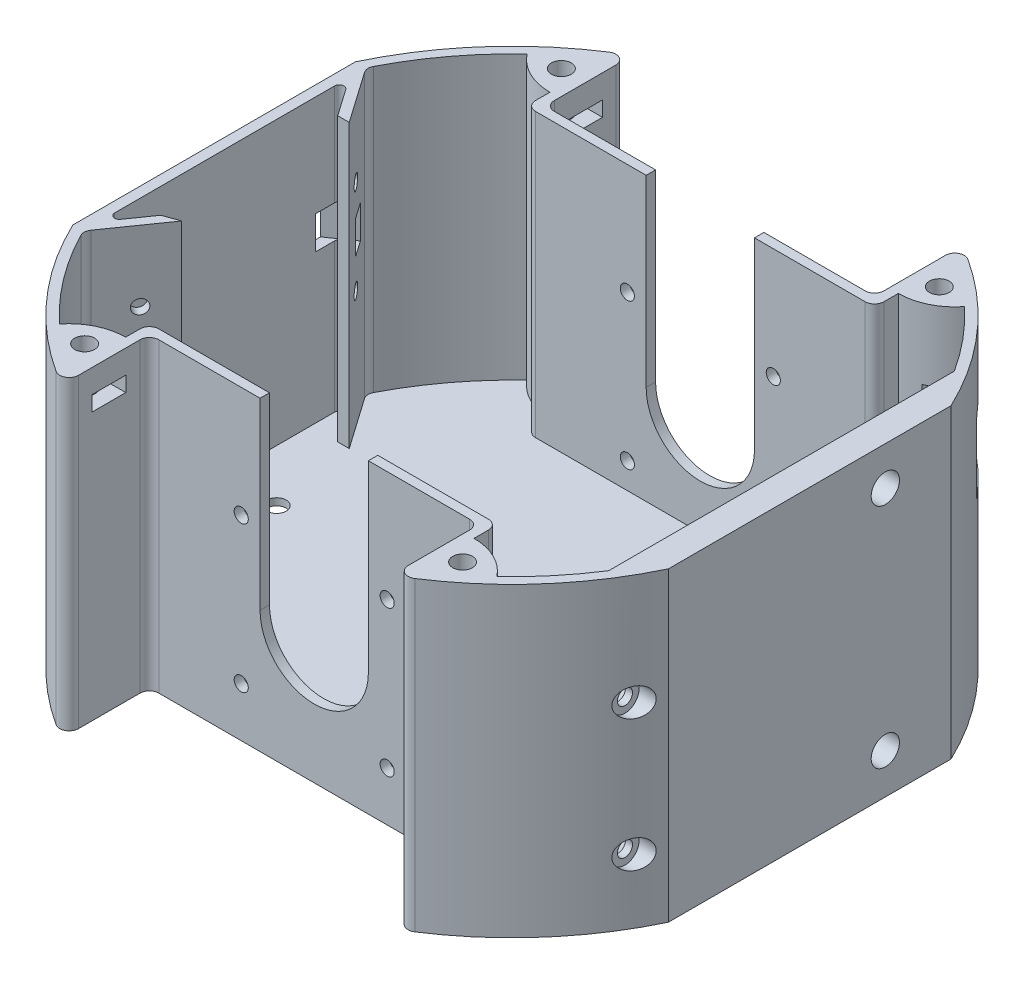
from build123d import *

# Parameters (mm, degrees)
ESQUISSE1_R                   = 2.05
BOSS_EXTRU_1_DEPTH            = 5
BOSS_EXTRU_2_DEPTH            = 60
ENL_V_MAT_EXTRU_1_DEPTH       = 136.461220507
ENL_V_MAT_EXTRU_1_DEPTH_BACK  = 136.461220507
ESQUISSE4_R                   = 1.5
ESQUISSE7_R                   = 2.1
ENL_V_MAT_EXTRU_2_DEPTH       = 13
ESQUISSE8_W                   = 7.2
ESQUISSE8_H                   = 3.2
ENL_V_MAT_EXTRU_3_DEPTH       = 5
ENL_V_START                   = -5
ESQUISSE10_R                  = 2.1
ENL_V_MAT_EXTRU_4_DEPTH       = 3.2
SYM_TRIE2_COPY_1_SKETCH_R     = 2.1
SYM_TRIE2_COPY_1_DEPTH        = 13
SYM_TRIE2_COPY_2_SKETCH_W     = 7.2
SYM_TRIE2_COPY_2_SKETCH_H     = 3.2
SYM_TRIE2_COPY_2_DEPTH        = 5
SYM_TRIE2_START               = -5
SYM_TRIE2_COPY_3_SKETCH_R     = 2.1
SYM_TRIE2_COPY_3_DEPTH        = 3.2
CONG_1_R                      = 2
CONG_2_R                      = 1
ESQUISSE13_R                  = 12.75
ESQUISSE13_R_2                = 2.05
ENL_V_MAT_EXTRU_5_DEPTH       = 3.5
ESQUISSE14_R                  = 1.5
ESQUISSE14_W                  = 4
ESQUISSE14_H                  = 7
ENL_V_MAT_EXTRU_6_DEPTH       = 5
ESQUISSE16_W                  = 4
ESQUISSE16_H                  = 7
ENL_V_MAT_EXTRU_8_DEPTH       = 136.661761577
ENL_V_MAT_EXTRU_10_DEPTH      = 2.5
ENL_V_MAT_EXTRU_10_DEPTH_BACK = 10
ESQUISSE18_R                  = 1.6
ENL_V_START_2                 = -4.5
ESQUISSE19_R                  = 3
ESQUISSE19_R_2                = 1.6
ENL_V_MAT_EXTRU_11_DEPTH      = 4.5
ENL_V_MAT_EXTRU_12_DEPTH      = 0.2
CHANFREIN1_SIZE               = 2
CHANFREIN1_SIZE_2             = 2.856296013
ESQUISSE21_W                  = 12
ESQUISSE21_H                  = 15
ENL_V_MAT_EXTRU_13_DEPTH      = 109.222966447


with BuildPart() as part:
    # Esquisse1 → Boss.-Extru.1 (new body)
    with BuildSketch(Plane(origin=(0, 0, 0), x_dir=(1, 0, 0), z_dir=(0, 1, 0))):
        with BuildLine():
            Line((35, 42), (-35, 42))
            Line((-35, 42), (-35, 60.621778265))
            ThreePointArc((-35, 60.621778265), (-51.453576232, 47.460820609), (-63.245553203, 30))
            Line((-63.245553203, 30), (-63.245553203, -30))
            ThreePointArc((-63.245553203, -30), (-51.453576232, -47.460820609), (-35, -60.621778265))
            Line((-35, -60.621778265), (-35, -42))
            Line((-35, -42), (35, -42))
            Line((35, -42), (35, -60.621778265))
            ThreePointArc((35, -60.621778265), (51.453576232, -47.460820609), (63.245553203, -30))
            Line((63.245553203, -30), (63.245553203, 30))
            ThreePointArc((63.245553203, 30), (51.453576232, 47.460820609), (35, 60.621778265))
            Line((35, 60.621778265), (35, 42))
        make_face()
        with Locations(Location((-50, 0, 0), (0, 0, 270))):
            Circle(ESQUISSE1_R, mode=Mode.SUBTRACT)
        with Locations(Location((50, 0, 0), (0, 0, 90))):
            Circle(ESQUISSE1_R, mode=Mode.SUBTRACT)
    extrude(amount=BOSS_EXTRU_1_DEPTH)

    # Esquisse3 → Boss.-Extru.2 (add)
    # profile 1 of 8: a face of its own
    with BuildSketch(Plane(origin=(0, 5, 0), x_dir=(1, 0, 0), z_dir=(0, 1, 0))):
        with BuildLine():
            Line((35, 42), (-35, 42))
            Line((-35, 42), (-35, 60.621778265))
            ThreePointArc((-35, 60.621778265), (-51.453576232, 47.460820609), (-63.245553203, 30))
            Line((-63.245553203, 30), (-63.245553203, -30))
            ThreePointArc((-63.245553203, -30), (-51.453576232, -47.460820609), (-35, -60.621778265))
            Line((-35, -60.621778265), (-35, -42))
            Line((-35, -42), (35, -42))
            Line((35, -42), (35, -60.621778265))
            ThreePointArc((35, -60.621778265), (51.453576232, -47.460820609), (63.245553203, -30))
            Line((63.245553203, -30), (63.245553203, 30))
            ThreePointArc((63.245553203, 30), (51.453576232, 47.460820609), (35, 60.621778265))
            Line((35, 60.621778265), (35, 42))
        make_face()
        with BuildLine():
            Line((37, 40), (37, 57.052607302))
            ThreePointArc((37, 57.052607302), (50.844524945, 45.153452616), (61.02458521, 30))
            Line((61.02458521, 30), (61.02458521, -30))
            ThreePointArc((61.02458521, -30), (50.844524945, -45.153452616), (37, -57.052607302))
            Line((37, -57.052607302), (37, -40))
            Line((37, -40), (-37, -40))
            Line((-37, -40), (-37, -57.052607302))
            ThreePointArc((-37, -57.052607302), (-50.844524945, -45.153452616), (-61.02458521, -30))
            Line((-61.02458521, -30), (-61.02458521, 30))
            ThreePointArc((-61.02458521, 30), (-50.844524945, 45.153452616), (-37, 57.052607302))
            Line((-37, 57.052607302), (-37, 40))
            Line((-37, 40), (37, 40))
        make_face(mode=Mode.SUBTRACT)
    # profile 2 of 8: a face of its own
    with BuildSketch(Plane(origin=(0, 5, 0), x_dir=(1, 0, 0), z_dir=(0, 1, 0))):
        Polygon((-61.02458521, 30), (-61.02458521, 26.513106409), (-54.059242753, 16.565566463), (-52.420938664, 17.712719336), align=None)
    # profile 3 of 8: a face of its own
    with BuildSketch(Plane(origin=(0, 5, 0), x_dir=(1, 0, 0), z_dir=(0, 1, 0))):
        with BuildLine():
            ThreePointArc((-37, -45.052607302), (-42.257961257, -46.265863428), (-46.452713564, -49.660300065))
            ThreePointArc((-46.452713564, -49.660300065), (-41.88974101, -53.56537686), (-37, -57.052607302))
            Line((-37, -57.052607302), (-37, -45.052607302))
        make_face()
    # profile 4 of 8: a face of its own
    with BuildSketch(Plane(origin=(0, 5, 0), x_dir=(1, 0, 0), z_dir=(0, 1, 0))):
        with BuildLine():
            Line((37, 57.052607302), (37, 45.052607302))
            ThreePointArc((37, 45.052607302), (42.257961257, 46.265863428), (46.452713564, 49.660300065))
            ThreePointArc((46.452713564, 49.660300065), (41.88974101, 53.56537686), (37, 57.052607302))
        make_face()
    # profile 5 of 8: a face of its own
    with BuildSketch(Plane(origin=(0, 5, 0), x_dir=(1, 0, 0), z_dir=(0, 1, 0))):
        with BuildLine():
            ThreePointArc((46.452713564, -49.660300065), (42.257961257, -46.265863428), (37, -45.052607302))
            Line((37, -45.052607302), (37, -57.052607302))
            ThreePointArc((37, -57.052607302), (41.88974101, -53.56537686), (46.452713564, -49.660300065))
        make_face()
    # profile 6 of 8: a face of its own
    with BuildSketch(Plane(origin=(0, 5, 0), x_dir=(1, 0, 0), z_dir=(0, 1, 0))):
        Polygon((-61.02458521, -26.513106409), (-61.02458521, -30), (-52.420938664, -17.712719336), (-54.059242753, -16.565566463), align=None)
    # profile 7 of 8: a face of its own
    with BuildSketch(Plane(origin=(0, 5, 0), x_dir=(1, 0, 0), z_dir=(0, 1, 0))):
        with BuildLine():
            Line((57.245553203, 36.700771633), (57.245553203, -36.700771633))
            ThreePointArc((57.245553203, -36.700771633), (59.229903724, -33.403869609), (61.02458521, -30))
            Line((61.02458521, -30), (61.02458521, 30))
            ThreePointArc((61.02458521, 30), (59.229903724, 33.403869609), (57.245553203, 36.700771633))
        make_face()
    # profile 8 of 8: a face of its own
    with BuildSketch(Plane(origin=(0, 5, 0), x_dir=(1, 0, 0), z_dir=(0, 1, 0))):
        with BuildLine():
            ThreePointArc((-37, 57.052607302), (-41.88974101, 53.56537686), (-46.452713564, 49.660300065))
            ThreePointArc((-46.452713564, 49.660300065), (-42.257961257, 46.265863428), (-37, 45.052607302))
            Line((-37, 45.052607302), (-37, 57.052607302))
        make_face()
    extrude(amount=BOSS_EXTRU_2_DEPTH)

    # Esquisse4 → Enlèv. mat.-Extru.1 (cut, two sides: drawn at the far end of the back side and taken through both)
    with BuildSketch(Plane.XY.offset(-40).offset(-ENL_V_MAT_EXTRU_1_DEPTH_BACK)):
        with BuildLine():
            Line((11.5, 26), (11.5, 65))
            Line((11.5, 65), (-11.5, 65))
            Line((-11.5, 65), (-11.5, 26))
            ThreePointArc((-11.5, 26), (0, 14.5), (11.5, 26))
        make_face()
        with Locations((-15.5, 10.5)):
            Circle(ESQUISSE4_R)
        with Locations((-15.5, 41.5)):
            Circle(ESQUISSE4_R)
        with Locations((15.5, 41.5)):
            Circle(ESQUISSE4_R)
        with Locations((15.5, 10.5)):
            Circle(ESQUISSE4_R)
    extrude(amount=ENL_V_MAT_EXTRU_1_DEPTH + ENL_V_MAT_EXTRU_1_DEPTH_BACK, mode=Mode.SUBTRACT)

    # Esquisse7 → Enlèv. mat.-Extru.2 (cut)
    with BuildSketch(Plane(origin=(0, 65, 0), x_dir=(1, 0, 0), z_dir=(0, 1, 0))):
        with Locations(Location((-40.134685529, -50.621778265, 0), (0, 0, 270))):
            Circle(ESQUISSE7_R)
    enl_v_mat_extru_2 = extrude(amount=-ENL_V_MAT_EXTRU_2_DEPTH, mode=Mode.SUBTRACT)

    # Esquisse8 → Enlèv. mat.-Extru.3 (cut)
    with BuildSketch(Plane(origin=(-35, 0, 0), x_dir=(0, 0, -1), z_dir=(1, 0, 0))):
        with Locations((-50.621778265, 58.4)):
            Rectangle(ESQUISSE8_W, ESQUISSE8_H)
    enl_v_mat_extru_3 = extrude(amount=-ENL_V_MAT_EXTRU_3_DEPTH, mode=Mode.SUBTRACT)

    # Esquisse10 → Enlèv. mat.-Extru.4 (cut)
    with BuildSketch(Plane(origin=(0, 65, 0), x_dir=(1, 0, 0), z_dir=(0, 1, 0)).offset(ENL_V_START)):
        Polygon((-35.977763591, -50.621778265), (-38.05622456, -47.021778265), (-42.213146498, -47.021778265), (-44.291607467, -50.621778265), (-42.213146498, -54.221778265), (-38.05622456, -54.221778265), align=None)
        with Locations(Location((-40.134685529, -50.621778265, 0), (0, 0, 270))):
            Circle(ESQUISSE10_R, mode=Mode.SUBTRACT)
    enl_v_mat_extru_4 = extrude(amount=-ENL_V_MAT_EXTRU_4_DEPTH, mode=Mode.SUBTRACT)

    # Symétrie1: Enlèv. mat.-Extru.2, Enlèv. mat.-Extru.3, Enlèv. mat.-Extru.4 across plane
    add(enl_v_mat_extru_2.mirror(Plane(origin=(0, 0, 0), x_dir=(0, 0, 1), z_dir=(1, 0, 0))), mode=Mode.SUBTRACT)
    add(enl_v_mat_extru_3.mirror(Plane(origin=(0, 0, 0), x_dir=(0, 0, 1), z_dir=(1, 0, 0))), mode=Mode.SUBTRACT)
    add(enl_v_mat_extru_4.mirror(Plane(origin=(0, 0, 0), x_dir=(0, 0, 1), z_dir=(1, 0, 0))), mode=Mode.SUBTRACT)

    # Symétrie2: Enlèv. mat.-Extru.2, Enlèv. mat.-Extru.3, Enlèv. mat.-Extru.4 across plane
    add(enl_v_mat_extru_2.mirror(Plane.XY), mode=Mode.SUBTRACT)
    add(enl_v_mat_extru_3.mirror(Plane.XY), mode=Mode.SUBTRACT)
    add(enl_v_mat_extru_4.mirror(Plane.XY), mode=Mode.SUBTRACT)

    # Symétrie2 copy 1 sketch → Symétrie2 copy 1 (cut)
    with BuildSketch(Plane(origin=(0, 65, 0), x_dir=(-1, 0, 0), z_dir=(0, 1, 0))):
        with Locations(Location((-40.134685529, -50.621778265, 0), (0, 0, 270))):
            Circle(SYM_TRIE2_COPY_1_SKETCH_R)
    extrude(amount=-SYM_TRIE2_COPY_1_DEPTH, mode=Mode.SUBTRACT)

    # Symétrie2 copy 2 sketch → Symétrie2 copy 2 (cut)
    with BuildSketch(Plane.ZY.offset(-35)):
        with Locations((-50.621778265, 58.4)):
            Rectangle(SYM_TRIE2_COPY_2_SKETCH_W, SYM_TRIE2_COPY_2_SKETCH_H)
    extrude(amount=-SYM_TRIE2_COPY_2_DEPTH, mode=Mode.SUBTRACT)

    # Symétrie2 copy 3 sketch → Symétrie2 copy 3 (cut)
    with BuildSketch(Plane(origin=(0, 65, 0), x_dir=(-1, 0, 0), z_dir=(0, 1, 0)).offset(SYM_TRIE2_START)):
        Polygon((-35.977763591, -50.621778265), (-38.05622456, -47.021778265), (-42.213146498, -47.021778265), (-44.291607467, -50.621778265), (-42.213146498, -54.221778265), (-38.05622456, -54.221778265), align=None)
        with Locations(Location((-40.134685529, -50.621778265, 0), (0, 0, 270))):
            Circle(SYM_TRIE2_COPY_3_SKETCH_R, mode=Mode.SUBTRACT)
    extrude(amount=-SYM_TRIE2_COPY_3_DEPTH, mode=Mode.SUBTRACT)

    # Congé1
    cong_1_edges = [part.edges().sort_by_distance(p)[0] for p in [
        (-35, 32.5, -42),
        (35, 32.5, -42),
        (35, 32.5, -60.621778265),
        (35, 32.5, 60.621778265),
        (35, 32.5, 42),
        (-35, 32.5, 42),
        (-35, 32.5, 60.621778265),
        (-35, 32.5, -60.621778265),
        (37, 35, 40),
        (-37, 35, 40),
        (-61.02458521, 35, 30),
        (-61.02458521, 35, -30),
        (-37, 35, -40),
        (37, 35, -40),
    ]]
    fillet(cong_1_edges, radius=CONG_1_R)

    # Congé2
    cong_2_edges = [part.edges().sort_by_distance(p)[0] for p in [
        (-61.02458521, 35, 26.513106409),
        (-61.02458521, 35, -26.513106409),
    ]]
    fillet(cong_2_edges, radius=CONG_2_R)

    # Esquisse13 → Enlèv. mat.-Extru.5 (cut)
    # profile 1 of 2: a face of its own
    with BuildSketch(Plane.XZ):
        with Locations(Location((-50, 0, 0), (0, 0, 270))):
            Circle(ESQUISSE13_R)
        with Locations(Location((-50, 0, 0), (0, 0, 270))):
            Circle(ESQUISSE13_R_2, mode=Mode.SUBTRACT)
    # profile 2 of 2: a face of its own
    with BuildSketch(Plane.XZ):
        with Locations(Location((50, 0, 0), (0, 0, 270))):
            Circle(ESQUISSE13_R)
        with Locations(Location((50, 0, 0), (0, 0, 270))):
            Circle(ESQUISSE13_R_2, mode=Mode.SUBTRACT)
    extrude(amount=-ENL_V_MAT_EXTRU_5_DEPTH, mode=Mode.SUBTRACT)

    # Esquisse14 → Enlèv. mat.-Extru.6 (cut)
    with BuildSketch(Plane(origin=(-26.852721983, 0, -18.802478354), x_dir=(0.5735764363510413, 0, -0.8191520442889951), z_dir=(0.8191520442889951, 0, 0.5735764363510413))):
        with Locations((-50.926825443, 50)):
            Circle(ESQUISSE14_R)
        with Locations((-50.926825443, 30)):
            Circle(ESQUISSE14_R)
        with Locations((-52.776825443, 40)):
            Rectangle(ESQUISSE14_W, ESQUISSE14_H)
    enl_v_mat_extru_6 = extrude(amount=-ENL_V_MAT_EXTRU_6_DEPTH, mode=Mode.SUBTRACT)

    # Esquisse16 → Enlèv. mat.-Extru.8 (cut, through all)
    with BuildSketch(Plane(origin=(-26.852721983, 0, -18.802478354), x_dir=(0.5735764363510413, 0, -0.8191520442889951), z_dir=(0.8191520442889951, 0, 0.5735764363510413))):
        with Locations((-52.776825443, 40)):
            Rectangle(ESQUISSE16_W, ESQUISSE16_H)
    enl_v_mat_extru_8 = extrude(amount=-ENL_V_MAT_EXTRU_8_DEPTH, mode=Mode.SUBTRACT)

    # Symétrie3: Enlèv. mat.-Extru.6, Enlèv. mat.-Extru.8 across plane
    add(enl_v_mat_extru_6.mirror(Plane.XY), mode=Mode.SUBTRACT)
    add(enl_v_mat_extru_8.mirror(Plane.XY), mode=Mode.SUBTRACT)

    # Esquisse18 → Enlèv. mat.-Extru.10 (cut, two sides: drawn at the far end of the back side and taken through both)
    with BuildSketch(Plane.ZY.offset(-57.245553203).offset(-ENL_V_MAT_EXTRU_10_DEPTH_BACK)):
        with Locations(Location((-16.05, 56.8, 0), (0, 0, 180))):
            Circle(ESQUISSE18_R)
        with Locations(Location((-16.05, 8.54, 0), (0, 0, 180))):
            Circle(ESQUISSE18_R)
        with Locations(Location((34.75, 41.56, 0), (0, 0, 180))):
            Circle(ESQUISSE18_R)
        with Locations(Location((34.75, 13.62, 0), (0, 0, 180))):
            Circle(ESQUISSE18_R)
    extrude(amount=ENL_V_MAT_EXTRU_10_DEPTH + ENL_V_MAT_EXTRU_10_DEPTH_BACK, mode=Mode.SUBTRACT)

    # Esquisse19 → Enlèv. mat.-Extru.11 (cut)
    # profile 1 of 4: a face of its own
    with BuildSketch(Plane(origin=(63.245553203, 0, 0), x_dir=(0, 0, -1), z_dir=(1, 0, 0)).offset(ENL_V_START_2)):
        with Locations((-34.75, 41.56)):
            Circle(ESQUISSE19_R)
        with Locations((-34.75, 41.56)):
            Circle(ESQUISSE19_R_2, mode=Mode.SUBTRACT)
    # profile 2 of 4: a face of its own
    with BuildSketch(Plane(origin=(63.245553203, 0, 0), x_dir=(0, 0, -1), z_dir=(1, 0, 0)).offset(ENL_V_START_2)):
        with Locations((16.05, 56.8)):
            Circle(ESQUISSE19_R)
        with Locations((16.05, 56.8)):
            Circle(ESQUISSE19_R_2, mode=Mode.SUBTRACT)
    # profile 3 of 4: a face of its own
    with BuildSketch(Plane(origin=(63.245553203, 0, 0), x_dir=(0, 0, -1), z_dir=(1, 0, 0)).offset(ENL_V_START_2)):
        with Locations((-34.75, 13.62)):
            Circle(ESQUISSE19_R)
        with Locations((-34.75, 13.62)):
            Circle(ESQUISSE19_R_2, mode=Mode.SUBTRACT)
    # profile 4 of 4: a face of its own
    with BuildSketch(Plane(origin=(63.245553203, 0, 0), x_dir=(0, 0, -1), z_dir=(1, 0, 0)).offset(ENL_V_START_2)):
        with Locations((16.05, 8.54)):
            Circle(ESQUISSE19_R)
        with Locations((16.05, 8.54)):
            Circle(ESQUISSE19_R_2, mode=Mode.SUBTRACT)
    extrude(amount=ENL_V_MAT_EXTRU_11_DEPTH, mode=Mode.SUBTRACT)

    # Esquisse20 → Enlèv. mat.-Extru.12 (cut)
    # profile 1 of 7: a face of its own
    with BuildSketch(Plane.XZ):
        Polygon((-6.879166667, 16.896126302), (-6.879166667, 18.168055556), (0, 18.168055556), (0, 17.550694444), (-6.173611111, 17.550694444), (-6.173611111, 16.492361111), align=None)
    # profile 2 of 7: a face of its own
    with BuildSketch(Plane.XZ):
        Polygon((-6.879166667, 8.819444444), (-6.879166667, 9.480902778), (-1.45796441, 11.773958333), (-6.879166667, 14.067013889), (-6.879166667, 14.728472222), (0, 11.818055556), (0, 11.729861111), align=None)
    # profile 3 of 7: a face of its own
    with BuildSketch(Plane.XZ):
        with BuildLine():
            Line((-1.5875, 4.478624132), (-1.299490017, 5.027083333))
            add(Edge.make_bspline(
                [(-1.299490017, 5.027083333), (-1.221983466, 4.983354906), (-1.071186411, 4.898276703), (-0.863997765, 4.752562347), (-0.67871717, 4.598413062), (-0.518311501, 4.431138699), (-0.376653377, 4.255779942), (-0.254465324, 4.069006183), (-0.149542627, 3.872341941), (-0.063568268, 3.663621059), (0.004021076, 3.443093562), (0.053936267, 3.209479795), (0.082882335, 2.96167672), (0.086395517, 2.79198151), (0.088194444, 2.705088976)],
                knots=[0, 0, 0, 0, 1.120611642, 2.180266485, 3.186550691, 4.152466804, 5.095166165, 6.022949561, 6.960161436, 7.899497276, 8.862391909, 9.862399089, 10.905440174, 12, 12, 12, 12], degree=3))
            add(Edge.make_bspline(
                [(0.088194444, 2.705088976), (0.085939699, 2.608501589), (0.081541343, 2.420087579), (0.043622464, 2.145825526), (-0.018235711, 1.887602416), (-0.104648924, 1.645432718), (-0.217521004, 1.419909656), (-0.355024545, 1.210584377), (-0.516454125, 1.016358409), (-0.703204444, 0.843343387), (-0.903066216, 0.687611956), (-1.111289961, 0.550100205), (-1.327154576, 0.435670714), (-1.549375714, 0.341166728), (-1.7774484, 0.266620991), (-2.012678834, 0.213647642), (-2.254134258, 0.183392775), (-2.417456698, 0.178735748), (-2.499761285, 0.176388889)],
                knots=[0, 0, 0, 0, 1.14524686, 2.234044844, 3.276713788, 4.290115724, 5.276966211, 6.260758605, 7.254862358, 8.264742877, 9.274005885, 10.257798278, 11.220590477, 12.167824544, 13.118936889, 14.062732937, 15.023735098, 16, 16, 16, 16], degree=3))
            add(Edge.make_bspline(
                [(-2.499761285, 0.176388889), (-2.576994338, 0.178470606), (-2.730060051, 0.182596294), (-2.956611735, 0.208601092), (-3.176800991, 0.254688154), (-3.390810781, 0.317929952), (-3.59828278, 0.399597937), (-3.799343257, 0.499507454), (-3.993778264, 0.617814139), (-4.116430138, 0.709155073), (-4.178211806, 0.755164931)],
                knots=[0, 0, 0, 0, 1.024358464, 2.0301432, 3.019427413, 4.004406732, 4.986367066, 5.972626655, 6.978780325, 8, 8, 8, 8], degree=3))
            add(Edge.make_bspline(
                [(-4.178211806, 0.755164931), (-4.252765578, 0.817378186), (-4.399271971, 0.939634101), (-4.590021088, 1.148557853), (-4.753190652, 1.371737242), (-4.886304705, 1.611417185), (-4.988690458, 1.867193955), (-5.06151609, 2.137748275), (-5.106831525, 2.42382795), (-5.112419556, 2.619938697), (-5.115277778, 2.720247396)],
                knots=[0, 0, 0, 0, 1.030811313, 2.025658015, 2.997072178, 3.962767568, 4.930766827, 5.917075773, 6.934604948, 8, 8, 8, 8], degree=3))
            add(Edge.make_bspline(
                [(-5.115277778, 2.720247396), (-5.112629756, 2.823337843), (-5.107434941, 3.0255778), (-5.058844141, 3.320378612), (-4.982723733, 3.599873073), (-4.871819912, 3.861754657), (-4.734347051, 4.110058574), (-4.560587791, 4.339070136), (-4.359466614, 4.555075861), (-4.204634642, 4.680673494), (-4.125846354, 4.744585503)],
                knots=[0, 0, 0, 0, 1.056389096, 2.072394598, 3.055233004, 4.020130009, 4.981825462, 5.957811105, 6.960805292, 8, 8, 8, 8], degree=3))
            add(Edge.make_bspline(
                [(-4.125846354, 4.744585503), (-4.066481934, 4.788075474), (-3.948148241, 4.874765932), (-3.755195169, 4.983352792), (-3.553319942, 5.07761191), (-3.339259346, 5.152954432), (-3.115549671, 5.213961833), (-2.880591646, 5.258100175), (-2.634455237, 5.283984747), (-2.466747923, 5.28907277), (-2.38125, 5.291666667)],
                knots=[0, 0, 0, 0, 0.94817472, 1.890038105, 2.849395472, 3.817997239, 4.812318967, 5.836947057, 6.897266129, 8, 8, 8, 8], degree=3))
            Line((-2.38125, 5.291666667), (-2.38125, 0.79375))
            add(Edge.make_bspline(
                [(-2.38125, 0.79375), (-2.31501254, 0.79677606), (-2.184759246, 0.802726684), (-1.994165481, 0.830469662), (-1.812607876, 0.874199097), (-1.641448231, 0.935657695), (-1.478451039, 1.010084078), (-1.324825417, 1.1012541), (-1.181271104, 1.210022676), (-1.046504028, 1.331343068), (-0.926490556, 1.466385228), (-0.819073791, 1.608455247), (-0.729043981, 1.759587718), (-0.655967793, 1.918590975), (-0.598760022, 2.0852079), (-0.559710293, 2.259490989), (-0.533555491, 2.441097286), (-0.530647245, 2.564894247), (-0.529166667, 2.627918837)],
                knots=[0, 0, 0, 0, 1.094153842, 2.151609401, 3.174256925, 4.172055639, 5.149267565, 6.128595816, 7.11444997, 8.118368179, 9.117203808, 10.09244225, 11.054858984, 12.015122123, 12.976791628, 13.957293641, 14.960065497, 16, 16, 16, 16], degree=3))
            add(Edge.make_bspline(
                [(-0.529166667, 2.627918837), (-0.530352164, 2.68954146), (-0.532704417, 2.811812564), (-0.555904976, 2.993856358), (-0.592675848, 3.173266637), (-0.645637087, 3.348261906), (-0.707653984, 3.516291827), (-0.780647472, 3.672756347), (-0.86386831, 3.815586925), (-0.958438368, 3.949601613), (-1.074500667, 4.07888554), (-1.217943525, 4.209166165), (-1.390393873, 4.345778012), (-1.519325527, 4.432675717), (-1.5875, 4.478624132)],
                knots=[0, 0, 0, 0, 0.991168677, 1.966668791, 2.94808785, 3.9350306, 4.905702032, 5.828266021, 6.709360349, 7.562606342, 8.463112863, 9.498839253, 10.677475166, 12, 12, 12, 12], degree=3))
        make_face()
        with BuildLine():
            add(Edge.make_bspline(
                [(-2.998611111, 4.674305556), (-3.080539419, 4.651800719), (-3.237815153, 4.608598745), (-3.455527924, 4.516592633), (-3.650133212, 4.415472717), (-3.818397111, 4.293744236), (-3.96807722, 4.15716955), (-4.096789521, 3.997237291), (-4.215421183, 3.820883904), (-4.314213114, 3.624596786), (-4.395396303, 3.416116522), (-4.455091041, 3.199728206), (-4.490181398, 2.977244287), (-4.495326123, 2.827395976), (-4.497916667, 2.751942274)],
                knots=[0, 0, 0, 0, 1.155085888, 2.217389643, 3.210301801, 4.133263417, 5.03575695, 5.95948047, 6.920061569, 7.923798377, 8.943125483, 9.960783337, 10.973185325, 12, 12, 12, 12], degree=3))
            add(Edge.make_bspline(
                [(-4.497916667, 2.751942274), (-4.49672846, 2.690320991), (-4.494379625, 2.568508669), (-4.471632805, 2.389126623), (-4.435081191, 2.216409749), (-4.38133767, 2.050873598), (-4.315942426, 1.891420109), (-4.23555844, 1.7381645), (-4.138372794, 1.593076898), (-4.064133187, 1.502397352), (-4.026627604, 1.456586372)],
                knots=[0, 0, 0, 0, 1.048823158, 2.073302879, 3.073550078, 4.050623576, 5.03253758, 6.005186856, 6.992227572, 8, 8, 8, 8], degree=3))
            add(Edge.make_bspline(
                [(-4.026627604, 1.456586372), (-3.996963204, 1.423770981), (-3.936929689, 1.357360629), (-3.833439568, 1.268718267), (-3.721779786, 1.18321339), (-3.597076292, 1.107229847), (-3.462945351, 1.03501877), (-3.318408243, 0.969215756), (-3.162854873, 0.909384609), (-3.054406359, 0.87579776), (-2.998611111, 0.858517795)],
                knots=[0, 0, 0, 0, 0.879905587, 1.780714457, 2.708106151, 3.677566983, 4.684151534, 5.740052498, 6.837288539, 8, 8, 8, 8], degree=3))
            Line((-2.998611111, 0.858517795), (-2.998611111, 4.674305556))
        make_face(mode=Mode.SUBTRACT)
    # profile 4 of 7: a face of its own
    with BuildSketch(Plane.XZ):
        with BuildLine():
            Line((-5.027083333, -1.675694444), (-5.027083333, -1.058333333))
            Line((-5.027083333, -1.058333333), (-1.03766276, -1.058333333))
            add(Edge.make_bspline(
                [(-1.03766276, -1.058333333), (-0.952680298, -1.058877854), (-0.788643674, -1.05992891), (-0.551453389, -1.067497902), (-0.332369452, -1.0834589), (-0.130392679, -1.101558344), (0.05354073, -1.127594449), (0.219979622, -1.159388714), (0.369083716, -1.195230507), (0.460920279, -1.226717863), (0.504361979, -1.241612413)],
                knots=[0, 0, 0, 0, 1.307562039, 2.523909702, 3.650326591, 4.686913197, 5.643429486, 6.506965704, 7.293745905, 8, 8, 8, 8], degree=3))
            add(Edge.make_bspline(
                [(0.504361979, -1.241612413), (0.560829824, -1.263604702), (0.67207716, -1.306931724), (0.829777708, -1.388076127), (0.978255293, -1.478953423), (1.116724544, -1.582722854), (1.244333597, -1.699041093), (1.364248326, -1.824492218), (1.471957318, -1.963477334), (1.568754224, -2.113562734), (1.6576407, -2.271718128), (1.733474541, -2.439132752), (1.796723187, -2.614907199), (1.84876585, -2.79823042), (1.890751591, -2.989091713), (1.918765075, -3.188126415), (1.937628129, -3.394661899), (1.939385954, -3.535083693), (1.940277778, -3.606325955)],
                knots=[0, 0, 0, 0, 0.98202571, 1.934689484, 2.871054655, 3.802072519, 4.735470746, 5.668036537, 6.612630213, 7.581518814, 8.561763468, 9.551722253, 10.55777311, 11.588015789, 12.63986657, 13.723744117, 14.845153492, 16, 16, 16, 16], degree=3))
            add(Edge.make_bspline(
                [(1.940277778, -3.606325955), (1.938383265, -3.710240564), (1.934683764, -3.913159344), (1.899321914, -4.209613212), (1.842282772, -4.490243953), (1.761015315, -4.753006308), (1.660520708, -4.99525654), (1.545398724, -5.215641777), (1.413328624, -5.412130527), (1.26297136, -5.589266994), (1.084183616, -5.749141804), (0.87348708, -5.899554415), (0.627671014, -6.044333229), (0.447254633, -6.129180161), (0.352777778, -6.173611111)],
                knots=[0, 0, 0, 0, 1.157856589, 2.260999188, 3.322382479, 4.345906448, 5.321474636, 6.242187631, 7.112686896, 7.955149481, 8.825136643, 9.778649332, 10.836767353, 12, 12, 12, 12], degree=3))
            Line((0.352777778, -6.173611111), (0.352777778, -5.55625))
            add(Edge.make_bspline(
                [(0.352777778, -5.55625), (0.43157965, -5.506575219), (0.585627606, -5.409467138), (0.785283717, -5.228474439), (0.954345813, -5.028664365), (1.091520308, -4.805797368), (1.19712204, -4.558319072), (1.270471831, -4.284628383), (1.314848032, -3.983976293), (1.320153766, -3.774607849), (1.322916667, -3.665581597)],
                knots=[0, 0, 0, 0, 0.997887113, 1.950746426, 2.877762071, 3.798308985, 4.747694893, 5.754452072, 6.830656281, 8, 8, 8, 8], degree=3))
            add(Edge.make_bspline(
                [(1.322916667, -3.665581597), (1.320117504, -3.557933837), (1.314720998, -3.350399729), (1.270454212, -3.052042597), (1.197099223, -2.779244651), (1.091735715, -2.53501885), (0.965177498, -2.320884574), (0.825207573, -2.13522515), (0.665506462, -1.986040584), (0.518604971, -1.885314842), (0.38764454, -1.822760746), (0.274926657, -1.782888556), (0.147875795, -1.750732102), (0.006188781, -1.723128123), (-0.150188767, -1.701255095), (-0.321790142, -1.686904187), (-0.507454674, -1.676718622), (-0.636178842, -1.676043731), (-0.702799479, -1.675694444)],
                knots=[0, 0, 0, 0, 1.570880491, 3.028500349, 4.391799536, 5.683507043, 6.897971719, 8.016608159, 9.065046722, 10.074948333, 10.602832593, 11.179761774, 11.817338097, 12.514350094, 13.286299219, 14.121078732, 15.027572402, 16, 16, 16, 16], degree=3))
            Line((-0.702799479, -1.675694444), (-0.963248698, -1.675694444))
            add(Edge.make_bspline(
                [(-0.963248698, -1.675694444), (-0.888705256, -1.738377124), (-0.740929567, -1.862639915), (-0.546944401, -2.076660108), (-0.381893665, -2.311899456), (-0.244604502, -2.565032773), (-0.135831829, -2.832287521), (-0.057016536, -3.108938608), (-0.008129607, -3.394209367), (-0.002729087, -3.587298741), (0, -3.684874132)],
                knots=[0, 0, 0, 0, 1.012670515, 2.007528466, 2.995541538, 3.996581493, 4.997861088, 5.991949332, 6.98525577, 8, 8, 8, 8], degree=3))
            add(Edge.make_bspline(
                [(0, -3.684874132), (-0.001212435, -3.742315502), (-0.003622055, -3.856475726), (-0.018279928, -4.026555808), (-0.046823755, -4.19335802), (-0.083374257, -4.357944907), (-0.132369183, -4.519166623), (-0.18987356, -4.678954897), (-0.260504144, -4.834989229), (-0.340024489, -4.988065755), (-0.429371126, -5.134583067), (-0.525903102, -5.274080491), (-0.629414647, -5.405700063), (-0.740847713, -5.528222402), (-0.86006169, -5.641478007), (-0.98578029, -5.746992474), (-1.119760462, -5.843020398), (-1.259558786, -5.93153246), (-1.406106511, -6.008299144), (-1.556225838, -6.075684261), (-1.709595787, -6.134273936), (-1.866729835, -6.180984268), (-2.027528919, -6.216659849), (-2.191729613, -6.243213878), (-2.359837554, -6.258275188), (-2.473090944, -6.260623783), (-2.530078125, -6.261805556)],
                knots=[0, 0, 0, 0, 1.028710361, 2.044481286, 3.053267669, 4.056977562, 5.061496029, 6.068537106, 7.095799505, 8.125955792, 9.155750787, 10.166547241, 11.162135275, 12.151998358, 13.129411568, 14.10464185, 15.088574784, 16.079052837, 17.065149435, 18.048153627, 19.024354702, 20.002874835, 20.980703288, 21.971932454, 22.97951087, 24, 24, 24, 24], degree=3))
            add(Edge.make_bspline(
                [(-2.530078125, -6.261805556), (-2.58708302, -6.260785147), (-2.700872021, -6.258748281), (-2.869665908, -6.241155344), (-3.036199596, -6.216059772), (-3.198756548, -6.176341883), (-3.359188054, -6.128536544), (-3.516309118, -6.069329379), (-3.670167595, -5.99814227), (-3.820877422, -5.917538584), (-3.966416247, -5.826961397), (-4.104641595, -5.727641009), (-4.234536323, -5.619457516), (-4.357410862, -5.503903405), (-4.472079678, -5.379567741), (-4.57826446, -5.246514845), (-4.677745123, -5.106056256), (-4.768375859, -4.957756655), (-4.848532393, -4.803904312), (-4.921672866, -4.648407986), (-4.979721475, -4.489207884), (-5.030869257, -4.329272095), (-5.067103194, -4.165783953), (-5.095056672, -4.00074804), (-5.112086975, -3.83359935), (-5.114212804, -3.721659791), (-5.115277778, -3.665581597)],
                knots=[0, 0, 0, 0, 1.008818848, 2.013730394, 3.001654427, 3.987803273, 4.973046549, 5.963777569, 6.957074694, 7.972068341, 8.987420212, 9.989399531, 10.982630087, 11.977756091, 12.973280677, 13.973972381, 14.989194003, 16.018387222, 17.047741039, 18.059210846, 19.057554164, 20.045176975, 21.029480261, 22.018708529, 23.007435371, 24, 24, 24, 24], degree=3))
            add(Edge.make_bspline(
                [(-5.115277778, -3.665581597), (-5.112611269, -3.573104097), (-5.107345733, -3.390489449), (-5.066029172, -3.121747919), (-5.000158177, -2.862418588), (-4.905784598, -2.611038083), (-4.776947559, -2.365558655), (-4.60724255, -2.126789354), (-4.395147347, -1.894039365), (-4.232498562, -1.750406629), (-4.147894965, -1.675694444)],
                knots=[0, 0, 0, 0, 0.96728863, 1.910097829, 2.838038873, 3.762875196, 4.71315279, 5.730631239, 6.819562287, 8, 8, 8, 8], degree=3))
            Line((-4.147894965, -1.675694444), (-5.027083333, -1.675694444))
        make_face()
        with BuildLine():
            add(Edge.make_bspline(
                [(-4.497916667, -3.615972222), (-4.49483717, -3.706242186), (-4.488740419, -3.884957573), (-4.437045922, -4.14701627), (-4.355224307, -4.399423881), (-4.241338204, -4.63969163), (-4.097406392, -4.862284689), (-3.926165232, -5.061487482), (-3.729963981, -5.235164187), (-3.511330174, -5.382120291), (-3.275089171, -5.499516024), (-3.026188148, -5.581521855), (-2.768974992, -5.635726768), (-2.593742815, -5.641519746), (-2.505273438, -5.644444444)],
                knots=[0, 0, 0, 0, 1.026191648, 2.031641866, 3.026511193, 4.038688626, 5.047555432, 6.033268986, 7.01798463, 8.019529538, 9.022150945, 10.008736843, 10.994672018, 12, 12, 12, 12], degree=3))
            add(Edge.make_bspline(
                [(-2.505273438, -5.644444444), (-2.438580559, -5.643012255), (-2.307415171, -5.640195558), (-2.114889763, -5.6133039), (-1.931239661, -5.569308863), (-1.756639287, -5.508525472), (-1.591066389, -5.4308562), (-1.434532526, -5.335060019), (-1.286950077, -5.221671891), (-1.149564389, -5.092249912), (-1.024442805, -4.949597069), (-0.914497243, -4.794877873), (-0.824575471, -4.628293043), (-0.746858847, -4.453942029), (-0.69009774, -4.267593715), (-0.646781041, -4.071932365), (-0.621998829, -3.865573683), (-0.618927187, -3.724901134), (-0.617361111, -3.653179253)],
                knots=[0, 0, 0, 0, 1.039710933, 2.044807362, 3.024849673, 3.981007225, 4.923240656, 5.871799057, 6.837597342, 7.820855272, 8.810901995, 9.792827897, 10.773995565, 11.758948565, 12.765014796, 13.806304263, 14.881544521, 16, 16, 16, 16], degree=3))
            add(Edge.make_bspline(
                [(-0.617361111, -3.653179253), (-0.618869828, -3.580527867), (-0.621820109, -3.43845885), (-0.647181628, -3.230961688), (-0.688106727, -3.034349719), (-0.746212149, -2.848803219), (-0.820353352, -2.673621621), (-0.914178537, -2.510772849), (-1.021030534, -2.356765116), (-1.145665338, -2.216515792), (-1.283022632, -2.089695081), (-1.432487062, -1.979174847), (-1.591809583, -1.885000139), (-1.760972233, -1.807014623), (-1.941289644, -1.747477983), (-2.132311043, -1.707541659), (-2.333121266, -1.679618639), (-2.470721535, -1.677022393), (-2.541102431, -1.675694444)],
                knots=[0, 0, 0, 0, 1.121943988, 2.193949579, 3.223793937, 4.220241907, 5.192961521, 6.155822191, 7.11847367, 8.083710714, 9.04790392, 10.001595906, 10.949595423, 11.902125208, 12.873731292, 13.87582262, 14.913508608, 16, 16, 16, 16], degree=3))
            add(Edge.make_bspline(
                [(-2.541102431, -1.675694444), (-2.632726765, -1.678332058), (-2.811728517, -1.683485028), (-3.072587839, -1.731960415), (-3.318113353, -1.810595688), (-3.547676815, -1.919728848), (-3.758080711, -2.057114433), (-3.943997074, -2.224210584), (-4.110553306, -2.413623454), (-4.247501686, -2.629985162), (-4.359130086, -2.86156726), (-4.440160017, -3.10495427), (-4.487861275, -3.357791723), (-4.494545579, -3.529416751), (-4.497916667, -3.615972222)],
                knots=[0, 0, 0, 0, 1.070678282, 2.091729125, 3.090678259, 4.078281522, 5.055707048, 6.018451281, 6.993304669, 7.996175111, 9.002951586, 9.993356152, 10.987991402, 12, 12, 12, 12], degree=3))
        make_face(mode=Mode.SUBTRACT)
    # profile 5 of 7: a face of its own
    with BuildSketch(Plane.XZ):
        with BuildLine():
            Line((-5.027083333, -9.172222222), (-5.027083333, -8.554861111))
            Line((-5.027083333, -8.554861111), (-4.287076823, -8.554861111))
            add(Edge.make_bspline(
                [(-4.287076823, -8.554861111), (-4.356009064, -8.50931332), (-4.487841441, -8.422203524), (-4.661964192, -8.276738989), (-4.807777277, -8.129329112), (-4.922500018, -7.976103179), (-5.009202395, -7.818563452), (-5.070125439, -7.658038379), (-5.107905673, -7.494135419), (-5.112817118, -7.383723886), (-5.115277778, -7.328407118)],
                knots=[0, 0, 0, 0, 1.280091057, 2.448164201, 3.510831157, 4.48793739, 5.405868014, 6.289422536, 7.142991551, 8, 8, 8, 8], degree=3))
            add(Edge.make_bspline(
                [(-5.115277778, -7.328407118), (-5.112937826, -7.285507993), (-5.108123223, -7.197240255), (-5.074295757, -7.063622094), (-5.020288358, -6.925953357), (-4.969500016, -6.837227069), (-4.943023003, -6.790972222)],
                knots=[0, 0, 0, 0, 0.901110191, 1.854092781, 2.881294221, 4, 4, 4, 4], degree=3))
            Line((-4.943023003, -6.790972222), (-4.408344184, -7.129969618))
            add(Edge.make_bspline(
                [(-4.408344184, -7.129969618), (-4.421592017, -7.159666039), (-4.446738939, -7.216035532), (-4.476500199, -7.298496233), (-4.49402422, -7.374523479), (-4.496679023, -7.422959807), (-4.497916667, -7.445540365)],
                knots=[0, 0, 0, 0, 1.180555205, 2.24091978, 3.179933427, 4, 4, 4, 4], degree=3))
            add(Edge.make_bspline(
                [(-4.497916667, -7.445540365), (-4.494640453, -7.495096508), (-4.487957925, -7.596176675), (-4.434672558, -7.74408138), (-4.351055661, -7.888888575), (-4.255840737, -8.002784449), (-4.164378476, -8.091283679), (-4.084328828, -8.154930079), (-3.99373845, -8.212053671), (-3.89610886, -8.267465072), (-3.788989834, -8.318946447), (-3.672206621, -8.364952619), (-3.546723572, -8.407977246), (-3.459472282, -8.432206733), (-3.414778646, -8.444618056)],
                knots=[0, 0, 0, 0, 1.125322384, 2.295331465, 3.535939348, 4.916963136, 5.656144286, 6.429838446, 7.238666481, 8.090384391, 8.983239461, 9.940052224, 10.944811494, 12, 12, 12, 12], degree=3))
            add(Edge.make_bspline(
                [(-3.414778646, -8.444618056), (-3.37492655, -8.453935537), (-3.286214541, -8.474676542), (-3.138062056, -8.494304559), (-2.963137374, -8.514478961), (-2.761237283, -8.528256045), (-2.531585676, -8.54127034), (-2.27517327, -8.548459972), (-1.991295311, -8.554632362), (-1.793291549, -8.554782429), (-1.689474826, -8.554861111)],
                knots=[0, 0, 0, 0, 0.566841273, 1.261806378, 2.068780918, 3.007109044, 4.065315289, 5.256255371, 6.561408263, 8, 8, 8, 8], degree=3))
            Line((-1.689474826, -8.554861111), (0, -8.554861111))
            Line((0, -8.554861111), (0, -9.172222222))
            Line((0, -9.172222222), (-5.027083333, -9.172222222))
        make_face()
    # profile 6 of 7: a face of its own
    with BuildSketch(Plane.XZ):
        with BuildLine():
            Line((-1.5875, -11.04359809), (-1.299490017, -10.495138889))
            add(Edge.make_bspline(
                [(-1.299490017, -10.495138889), (-1.221983466, -10.538867316), (-1.071186411, -10.623945519), (-0.863997765, -10.769659875), (-0.67871717, -10.92380916), (-0.518311501, -11.091083523), (-0.376653377, -11.26644228), (-0.254465324, -11.453216039), (-0.149542627, -11.649880281), (-0.063568268, -11.858601164), (0.004021076, -12.07912866), (0.053936267, -12.312742427), (0.082882335, -12.560545502), (0.086395517, -12.730240713), (0.088194444, -12.817133247)],
                knots=[0, 0, 0, 0, 1.120611642, 2.180266485, 3.186550691, 4.152466804, 5.095166165, 6.022949561, 6.960161436, 7.899497276, 8.862391909, 9.862399089, 10.905440174, 12, 12, 12, 12], degree=3))
            add(Edge.make_bspline(
                [(0.088194444, -12.817133247), (0.085939699, -12.913720633), (0.081541343, -13.102134643), (0.043622464, -13.376396696), (-0.018235711, -13.634619807), (-0.104648924, -13.876789505), (-0.217521004, -14.102312566), (-0.355024545, -14.311637846), (-0.516454125, -14.505863813), (-0.703204444, -14.678878835), (-0.903066216, -14.834610266), (-1.111289961, -14.972122017), (-1.327154576, -15.086551508), (-1.549375714, -15.181055494), (-1.7774484, -15.255601231), (-2.012678834, -15.308574581), (-2.254134258, -15.338829448), (-2.417456698, -15.343486475), (-2.499761285, -15.345833333)],
                knots=[0, 0, 0, 0, 1.14524686, 2.234044844, 3.276713788, 4.290115724, 5.276966211, 6.260758605, 7.254862358, 8.264742877, 9.274005885, 10.257798278, 11.220590477, 12.167824544, 13.118936889, 14.062732937, 15.023735098, 16, 16, 16, 16], degree=3))
            add(Edge.make_bspline(
                [(-2.499761285, -15.345833333), (-2.576994338, -15.343751616), (-2.730060051, -15.339625928), (-2.956611735, -15.31362113), (-3.176800991, -15.267534069), (-3.390810781, -15.20429227), (-3.59828278, -15.122624285), (-3.799343257, -15.022714768), (-3.993778264, -14.904408083), (-4.116430138, -14.813067149), (-4.178211806, -14.767057292)],
                knots=[0, 0, 0, 0, 1.024358464, 2.0301432, 3.019427413, 4.004406732, 4.986367066, 5.972626655, 6.978780325, 8, 8, 8, 8], degree=3))
            add(Edge.make_bspline(
                [(-4.178211806, -14.767057292), (-4.252765578, -14.704844036), (-4.399271971, -14.582588121), (-4.590021088, -14.373664369), (-4.753190652, -14.15048498), (-4.886304705, -13.910805037), (-4.988690458, -13.655028267), (-5.06151609, -13.384473947), (-5.106831525, -13.098394272), (-5.112419556, -12.902283525), (-5.115277778, -12.801974826)],
                knots=[0, 0, 0, 0, 1.030811313, 2.025658015, 2.997072178, 3.962767568, 4.930766827, 5.917075773, 6.934604948, 8, 8, 8, 8], degree=3))
            add(Edge.make_bspline(
                [(-5.115277778, -12.801974826), (-5.112629756, -12.698884379), (-5.107434941, -12.496644423), (-5.058844141, -12.20184361), (-4.982723733, -11.922349149), (-4.871819912, -11.660467565), (-4.734347051, -11.412163648), (-4.560587791, -11.183152086), (-4.359466614, -10.967146361), (-4.204634642, -10.841548728), (-4.125846354, -10.777636719)],
                knots=[0, 0, 0, 0, 1.056389096, 2.072394598, 3.055233004, 4.020130009, 4.981825462, 5.957811105, 6.960805292, 8, 8, 8, 8], degree=3))
            add(Edge.make_bspline(
                [(-4.125846354, -10.777636719), (-4.066481934, -10.734146748), (-3.948148241, -10.64745629), (-3.755195169, -10.53886943), (-3.553319942, -10.444610312), (-3.339259346, -10.36926779), (-3.115549671, -10.308260389), (-2.880591646, -10.264122047), (-2.634455237, -10.238237475), (-2.466747923, -10.233149452), (-2.38125, -10.230555556)],
                knots=[0, 0, 0, 0, 0.94817472, 1.890038105, 2.849395472, 3.817997239, 4.812318967, 5.836947057, 6.897266129, 8, 8, 8, 8], degree=3))
            Line((-2.38125, -10.230555556), (-2.38125, -14.728472222))
            add(Edge.make_bspline(
                [(-2.38125, -14.728472222), (-2.31501254, -14.725446162), (-2.184759246, -14.719495538), (-1.994165481, -14.69175256), (-1.812607876, -14.648023125), (-1.641448231, -14.586564527), (-1.478451039, -14.512138144), (-1.324825417, -14.420968122), (-1.181271104, -14.312199547), (-1.046504028, -14.190879154), (-0.926490556, -14.055836994), (-0.819073791, -13.913766975), (-0.729043981, -13.762634504), (-0.655967793, -13.603631247), (-0.598760022, -13.437014322), (-0.559710293, -13.262731234), (-0.533555491, -13.081124936), (-0.530647245, -12.957327975), (-0.529166667, -12.894303385)],
                knots=[0, 0, 0, 0, 1.094153842, 2.151609401, 3.174256925, 4.172055639, 5.149267565, 6.128595816, 7.11444997, 8.118368179, 9.117203808, 10.09244225, 11.054858984, 12.015122123, 12.976791628, 13.957293641, 14.960065497, 16, 16, 16, 16], degree=3))
            add(Edge.make_bspline(
                [(-0.529166667, -12.894303385), (-0.530352164, -12.832680763), (-0.532704417, -12.710409658), (-0.555904976, -12.528365864), (-0.592675848, -12.348955585), (-0.645637087, -12.173960316), (-0.707653984, -12.005930396), (-0.780647472, -11.849465876), (-0.86386831, -11.706635297), (-0.958438368, -11.572620609), (-1.074500667, -11.443336682), (-1.217943525, -11.313056057), (-1.390393873, -11.17644421), (-1.519325527, -11.089546506), (-1.5875, -11.04359809)],
                knots=[0, 0, 0, 0, 0.991168677, 1.966668791, 2.94808785, 3.9350306, 4.905702032, 5.828266021, 6.709360349, 7.562606342, 8.463112863, 9.498839253, 10.677475166, 12, 12, 12, 12], degree=3))
        make_face()
        with BuildLine():
            add(Edge.make_bspline(
                [(-2.998611111, -10.847916667), (-3.080539419, -10.870421503), (-3.237815153, -10.913623477), (-3.455527924, -11.005629589), (-3.650133212, -11.106749505), (-3.818397111, -11.228477986), (-3.96807722, -11.365052672), (-4.096789521, -11.524984931), (-4.215421183, -11.701338318), (-4.314213114, -11.897625436), (-4.395396303, -12.1061057), (-4.455091041, -12.322494016), (-4.490181398, -12.544977936), (-4.495326123, -12.694826247), (-4.497916667, -12.770279948)],
                knots=[0, 0, 0, 0, 1.155085888, 2.217389643, 3.210301801, 4.133263417, 5.03575695, 5.95948047, 6.920061569, 7.923798377, 8.943125483, 9.960783337, 10.973185325, 12, 12, 12, 12], degree=3))
            add(Edge.make_bspline(
                [(-4.497916667, -12.770279948), (-4.49672846, -12.831901231), (-4.494379625, -12.953713554), (-4.471632805, -13.1330956), (-4.435081191, -13.305812473), (-4.38133767, -13.471348624), (-4.315942426, -13.630802113), (-4.23555844, -13.784057723), (-4.138372794, -13.929145324), (-4.064133187, -14.01982487), (-4.026627604, -14.065635851)],
                knots=[0, 0, 0, 0, 1.048823158, 2.073302879, 3.073550078, 4.050623576, 5.03253758, 6.005186856, 6.992227572, 8, 8, 8, 8], degree=3))
            add(Edge.make_bspline(
                [(-4.026627604, -14.065635851), (-3.996963204, -14.098451241), (-3.936929689, -14.164861593), (-3.833439568, -14.253503956), (-3.721779786, -14.339008833), (-3.597076292, -14.414992375), (-3.462945351, -14.487203452), (-3.318408243, -14.553006466), (-3.162854873, -14.612837614), (-3.054406359, -14.646424462), (-2.998611111, -14.663704427)],
                knots=[0, 0, 0, 0, 0.879905587, 1.780714457, 2.708106151, 3.677566983, 4.684151534, 5.740052498, 6.837288539, 8, 8, 8, 8], degree=3))
            Line((-2.998611111, -14.663704427), (-2.998611111, -10.847916667))
        make_face(mode=Mode.SUBTRACT)
    # profile 7 of 7: a face of its own
    with BuildSketch(Plane.XZ):
        with BuildLine():
            Line((-1.327050781, -20.461111111), (-1.675694444, -19.879578993))
            add(Edge.make_bspline(
                [(-1.675694444, -19.879578993), (-1.585155993, -19.825492553), (-1.411687813, -19.721865021), (-1.177288974, -19.548998719), (-0.978064068, -19.369879151), (-0.815172069, -19.183179878), (-0.686926936, -18.990040497), (-0.596117549, -18.789200172), (-0.539480436, -18.581335713), (-0.532601099, -18.439872881), (-0.529166667, -18.369249132)],
                knots=[0, 0, 0, 0, 1.272034388, 2.437168799, 3.508375237, 4.49857839, 5.41946034, 6.295179144, 7.148887113, 8, 8, 8, 8], degree=3))
            add(Edge.make_bspline(
                [(-0.529166667, -18.369249132), (-0.530886469, -18.308947049), (-0.534295982, -18.189398027), (-0.565733383, -18.013057667), (-0.617164906, -17.842652826), (-0.686885904, -17.679877437), (-0.772588168, -17.52904398), (-0.873647221, -17.3946567), (-0.99041734, -17.281180889), (-1.118572743, -17.18710807), (-1.255998316, -17.114315206), (-1.397595847, -17.059297652), (-1.545308162, -17.028484859), (-1.644785806, -17.023861132), (-1.694986979, -17.021527778)],
                knots=[0, 0, 0, 0, 1.09553864, 2.171907928, 3.244545276, 4.325730702, 5.384330216, 6.391480148, 7.371786628, 8.333890167, 9.27165687, 10.191402356, 11.087295184, 12, 12, 12, 12], degree=3))
            add(Edge.make_bspline(
                [(-1.694986979, -17.021527778), (-1.752281742, -17.024363264), (-1.868309885, -17.030105431), (-2.039788675, -17.080711538), (-2.210219561, -17.157984944), (-2.3156619, -17.230613262), (-2.370225694, -17.268196615)],
                knots=[0, 0, 0, 0, 0.938992559, 1.901562324, 2.914110574, 4, 4, 4, 4], degree=3))
            add(Edge.make_bspline(
                [(-2.370225694, -17.268196615), (-2.409632231, -17.298992318), (-2.492361324, -17.363644046), (-2.615401572, -17.474885773), (-2.742574653, -17.604755804), (-2.876672462, -17.751476662), (-3.016581201, -17.915294461), (-3.163392646, -18.096272581), (-3.31410669, -18.295955567), (-3.415055944, -18.436112381), (-3.467144097, -18.50843099)],
                knots=[0, 0, 0, 0, 0.72225051, 1.516274602, 2.393638633, 3.3469932, 4.386926276, 5.505032946, 6.712638081, 8, 8, 8, 8], degree=3))
            add(Edge.make_bspline(
                [(-3.467144097, -18.50843099), (-3.518695762, -18.580807677), (-3.617258619, -18.719186393), (-3.763537777, -18.912704392), (-3.897276382, -19.085753688), (-4.019733435, -19.237565136), (-4.130925542, -19.368071963), (-4.229784944, -19.478302572), (-4.318985252, -19.56544895), (-4.376851509, -19.613908907), (-4.402832031, -19.635666233)],
                knots=[0, 0, 0, 0, 1.452282411, 2.77665338, 3.964542531, 5.026858415, 5.96415736, 6.766646006, 7.446254459, 8, 8, 8, 8], degree=3))
            add(Edge.make_bspline(
                [(-4.402832031, -19.635666233), (-4.443324889, -19.666072055), (-4.522959527, -19.725869184), (-4.647394385, -19.804887146), (-4.774531381, -19.871523209), (-4.904831288, -19.925152781), (-5.037314825, -19.968520984), (-5.172976627, -19.99867301), (-5.310895738, -20.017258082), (-5.403689537, -20.019177866), (-5.450141059, -20.020138889)],
                knots=[0, 0, 0, 0, 1.068019517, 2.100403715, 3.106014851, 4.09224787, 5.069873182, 6.043214339, 7.020455327, 8, 8, 8, 8], degree=3))
            add(Edge.make_bspline(
                [(-5.450141059, -20.020138889), (-5.522922342, -20.017573646), (-5.666929258, -20.01249799), (-5.877293742, -19.969569317), (-6.078146406, -19.90181984), (-6.267452484, -19.806874194), (-6.440455613, -19.684595595), (-6.598712985, -19.542473534), (-6.73357129, -19.37476563), (-6.849563601, -19.189100513), (-6.941290854, -18.986943231), (-7.007765915, -18.774115571), (-7.047251266, -18.552147409), (-7.052760261, -18.401560536), (-7.055555556, -18.32515191)],
                knots=[0, 0, 0, 0, 1.005248779, 1.989011071, 2.95484373, 3.928844559, 4.904706341, 5.875556129, 6.859318422, 7.868909462, 8.894684146, 9.918924798, 10.944050749, 12, 12, 12, 12], degree=3))
            add(Edge.make_bspline(
                [(-7.055555556, -18.32515191), (-7.05279753, -18.244074487), (-7.047312696, -18.08283737), (-6.998436647, -17.846045211), (-6.920648202, -17.617130891), (-6.829381976, -17.433800627), (-6.738809033, -17.290013464), (-6.656132045, -17.180467459), (-6.561147871, -17.068855565), (-6.451854099, -16.956377276), (-6.330436713, -16.841922199), (-6.195867907, -16.726017539), (-6.049360364, -16.607578629), (-5.944744401, -16.53140919), (-5.891113281, -16.492361111)],
                knots=[0, 0, 0, 0, 1.286507425, 2.558452658, 3.822738219, 5.118007103, 5.800084425, 6.519418873, 7.295692132, 8.12638276, 9.008892966, 9.945018126, 10.946518512, 12, 12, 12, 12], degree=3))
            Line((-5.891113281, -16.492361111), (-5.468055556, -17.05046658))
            add(Edge.make_bspline(
                [(-5.468055556, -17.05046658), (-5.511472863, -17.084164045), (-5.595084446, -17.149057484), (-5.712137027, -17.247618479), (-5.819204578, -17.340373823), (-5.9119565, -17.432459592), (-5.997338421, -17.516777842), (-6.069141852, -17.600067207), (-6.129635438, -17.679113539), (-6.194311131, -17.778512118), (-6.256482719, -17.904427348), (-6.31109315, -18.061171545), (-6.343490972, -18.225529239), (-6.347812343, -18.337413426), (-6.35, -18.394053819)],
                knots=[0, 0, 0, 0, 1.181392137, 2.275085037, 3.289537922, 4.225335853, 5.084247276, 5.86831218, 6.587234301, 7.222706459, 8.415108401, 9.595592188, 10.782789524, 12, 12, 12, 12], degree=3))
            add(Edge.make_bspline(
                [(-6.35, -18.394053819), (-6.347657429, -18.465135374), (-6.343140003, -18.602209455), (-6.292504671, -18.796361141), (-6.21551706, -18.972116867), (-6.104501728, -19.122767187), (-5.972150069, -19.247156821), (-5.821212322, -19.338252115), (-5.654507455, -19.392716389), (-5.538275121, -19.399382722), (-5.479079861, -19.402777778)],
                knots=[0, 0, 0, 0, 1.144248881, 2.206576175, 3.214949548, 4.222996039, 5.203671638, 6.127710127, 7.046472867, 8, 8, 8, 8], degree=3))
            add(Edge.make_bspline(
                [(-5.479079861, -19.402777778), (-5.442232728, -19.401960956), (-5.368025166, -19.400315933), (-5.258911542, -19.3792952), (-5.150373238, -19.350873442), (-5.042792253, -19.307301524), (-4.933732489, -19.246624021), (-4.821653564, -19.167028132), (-4.705590094, -19.0667577), (-4.630101127, -18.98995351), (-4.590245226, -18.949403212)],
                knots=[0, 0, 0, 0, 0.858259122, 1.72847414, 2.583651051, 3.473048463, 4.427392529, 5.488649985, 6.674082839, 8, 8, 8, 8], degree=3))
            add(Edge.make_bspline(
                [(-4.590245226, -18.949403212), (-4.576807214, -18.934344967), (-4.544881575, -18.898570023), (-4.492615081, -18.833166984), (-4.428142013, -18.74679846), (-4.348368608, -18.641719776), (-4.255831116, -18.51599345), (-4.151712742, -18.369605656), (-4.032633465, -18.204188167), (-3.949380728, -18.086806163), (-3.905360243, -18.024739583)],
                knots=[0, 0, 0, 0, 0.420754252, 0.999615792, 1.744751191, 2.668019286, 3.750313428, 4.999500688, 6.413464383, 8, 8, 8, 8], degree=3))
            add(Edge.make_bspline(
                [(-3.905360243, -18.024739583), (-3.851031771, -17.950079228), (-3.745832213, -17.805509797), (-3.587777628, -17.599807103), (-3.433195534, -17.413298023), (-3.283083137, -17.245313936), (-3.138545534, -17.094241496), (-2.997955865, -16.961603602), (-2.862236098, -16.846798444), (-2.689418156, -16.721514565), (-2.475203991, -16.595014987), (-2.212632931, -16.486551995), (-1.949308374, -16.417549697), (-1.772551326, -16.408588202), (-1.685340712, -16.404166667)],
                knots=[0, 0, 0, 0, 1.163604038, 2.253157948, 3.268574773, 4.215621239, 5.091738613, 5.902582348, 6.650434646, 7.330118262, 8.591011492, 9.77460283, 10.902005569, 12, 12, 12, 12], degree=3))
            add(Edge.make_bspline(
                [(-1.685340712, -16.404166667), (-1.623667936, -16.405459572), (-1.501520027, -16.408020277), (-1.322150846, -16.437406454), (-1.147984314, -16.480560228), (-0.981345521, -16.545078707), (-0.819560702, -16.625110008), (-0.665677568, -16.72520612), (-0.516706503, -16.841837037), (-0.376823937, -16.97555796), (-0.248253837, -17.121804465), (-0.134357427, -17.276933311), (-0.037202876, -17.439325092), (0.040171196, -17.610738402), (0.101094048, -17.789331806), (0.145112102, -17.97569424), (0.172157824, -18.170014486), (0.174962789, -18.302096179), (0.176388889, -18.369249132)],
                knots=[0, 0, 0, 0, 0.983922938, 1.948738757, 2.895227473, 3.844781104, 4.796118043, 5.772795661, 6.770647148, 7.813532943, 8.8582745, 9.876489951, 10.882905461, 11.874265028, 12.874055871, 13.891769171, 14.928133632, 16, 16, 16, 16], degree=3))
            add(Edge.make_bspline(
                [(0.176388889, -18.369249132), (0.175384174, -18.421207169), (0.173387396, -18.524468885), (0.155734905, -18.677205024), (0.130759389, -18.826855566), (0.091107759, -18.971542713), (0.042998754, -19.113130426), (-0.016237085, -19.251003538), (-0.087225857, -19.385226488), (-0.168385361, -19.516560581), (-0.262860716, -19.644636594), (-0.372799533, -19.768392116), (-0.495398402, -19.89108281), (-0.632551267, -20.011838349), (-0.785766335, -20.12802423), (-0.952761404, -20.242429701), (-1.134033082, -20.354497214), (-1.261509826, -20.424909371), (-1.327050781, -20.461111111)],
                knots=[0, 0, 0, 0, 0.915313873, 1.819100311, 2.706792138, 3.586475221, 4.459428225, 5.3405999, 6.2277379, 7.133009489, 8.059106158, 9.028520402, 10.047404263, 11.114294124, 12.246039232, 13.433834781, 14.680630578, 16, 16, 16, 16], degree=3))
        make_face()
    extrude(amount=-ENL_V_MAT_EXTRU_12_DEPTH, mode=Mode.SUBTRACT)

    # Chanfrein1
    # the kernel refuses this chamfer: 2.856296013, 2 mm, written as the material it takes off along each edge
    with BuildSketch(Plane(origin=(-54.059242753, 5, -16.565566463), x_dir=(-0.610066444958656, 0, -0.7923502588726193), z_dir=(0, 1, 0))) as chanfrein1_piece_1:
        Polygon((CHANFREIN1_SIZE * 0.998975071785, -CHANFREIN1_SIZE * 0.045263737714), (-CHANFREIN1_SIZE_2 * 0.0452637377217, -CHANFREIN1_SIZE_2 * 0.998975071955), (0, 0), align=None)
    extrude(amount=67.37653364, mode=Mode.SUBTRACT)
    with BuildSketch(Plane(origin=(-54.059242753, 5, 16.565566463), x_dir=(-0.5916280550067391, 0, 0.8062110421775076), z_dir=(0, 1, 0))) as chanfrein1_piece_2:
        Polygon((CHANFREIN1_SIZE_2 * 0.999753334934, CHANFREIN1_SIZE_2 * 0.0222096742022), (-CHANFREIN1_SIZE * 0.0222096741985, CHANFREIN1_SIZE * 0.999753334764), (0, 0), align=None)
    extrude(amount=67.37653364, mode=Mode.SUBTRACT)

    # Esquisse21 → Enlèv. mat.-Extru.13 (cut, through all)
    with BuildSketch(Plane.XY):
        with Locations((47.245553203, 42.5)):
            Rectangle(ESQUISSE21_W, ESQUISSE21_H)
    extrude(amount=-ENL_V_MAT_EXTRU_13_DEPTH, mode=Mode.SUBTRACT)


solid = part.part
